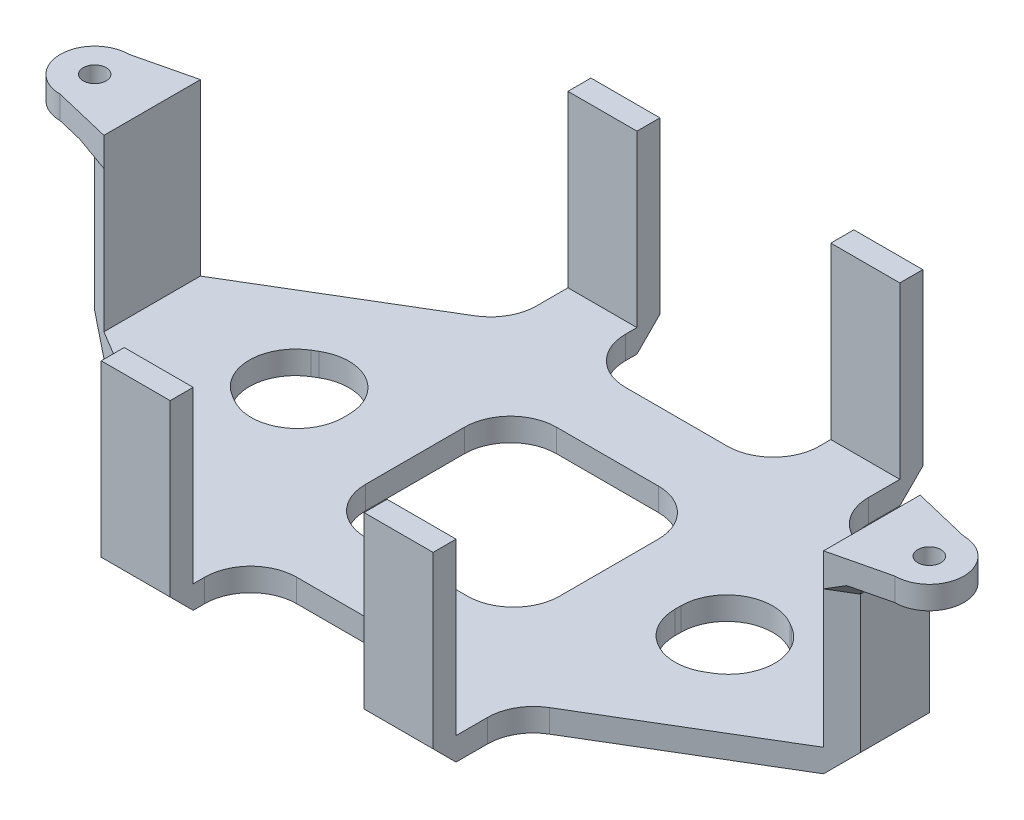
from build123d import *

# Parameters (mm, degrees)
SKETCH1_W           = 21.420666666
SKETCH1_H           = 21.082
BOSS_EXTRUDE1_DEPTH = 2.54
SKETCH2_W           = 7.62
SKETCH2_H           = 2.54
BOSS_EXTRUDE2_DEPTH = 18.796
FILLET1_R           = 5.08
CHAMFER1_SIZE       = 2.54
SKETCH3_R           = 1.27
BOSS_EXTRUDE3_DEPTH = 2.54
CHAMFER2_SIZE       = 0.635
CHAMFER2_SIZE_2     = 1.099852263


with BuildPart() as part:
    # Sketch1 → Boss-Extrude1 (new body)
    with BuildSketch(Plane(origin=(0, 0, 0), x_dir=(1, 0, 0), z_dir=(0, 1, 0))):
        Polygon((-2.54, 28.321), (21.420666667, 42.672), (21.420666667, 51.562), (29.040666667, 51.562), (29.040666667, 42.672), (50.461333333, 42.672), (50.461333333, 51.562), (58.081333333, 51.562), (58.081333333, 42.672), (82.042, 28.321), (82.042, 20.701), (58.081333333, 6.35), (58.081333333, -2.54), (50.461333333, -2.54), (50.461333333, 6.35), (29.040666667, 6.35), (29.040666667, -2.54), (21.420666667, -2.54), (21.420666667, 6.35), (-2.54, 20.701), align=None)
        Polygon((5.928658004, 24.511), (21.420666667, 33.789782574), (21.420666667, 15.232217426), align=None, mode=Mode.SUBTRACT)
        with Locations((39.751, 24.511)):
            Rectangle(SKETCH1_W, SKETCH1_H, mode=Mode.SUBTRACT)
        Polygon((58.081333333, 33.789782574), (73.573341996, 24.511), (58.081333333, 15.232217426), align=None, mode=Mode.SUBTRACT)
    extrude(amount=BOSS_EXTRUDE1_DEPTH)

    # Sketch2 → Boss-Extrude2 (add)
    with BuildSketch(Plane(origin=(0, 2.54, 0), x_dir=(1, 0, 0), z_dir=(0, 1, 0))):
        with Locations((25.230666667, 50.292)):
            Rectangle(SKETCH2_W, SKETCH2_H)
        with Locations((54.271333333, 50.292)):
            Rectangle(SKETCH2_W, SKETCH2_H)
        with Locations((25.230666667, -1.27)):
            Rectangle(SKETCH2_W, SKETCH2_H)
        with Locations((54.271333333, -1.27)):
            Rectangle(SKETCH2_W, SKETCH2_H)
        Polygon((-2.54, 20.701), (0, 19.17969258), (0, 29.84230742), (-2.54, 28.321), align=None)
        Polygon((82.042, 28.321), (79.502, 29.84230742), (79.502, 19.17969258), (82.042, 20.701), align=None)
    extrude(amount=BOSS_EXTRUDE2_DEPTH)

    # Fillet1
    fillet1_edges = [part.edges().sort_by_distance(p)[0] for p in [
        (29.040666667, 1.27, -42.672),
        (50.461333333, 1.27, -42.672),
        (58.081333333, 1.27, -42.672),
        (58.081333333, 1.27, -6.35),
        (50.461333333, 1.27, -6.35),
        (29.040666667, 1.27, -6.35),
        (21.420666667, 1.27, -6.35),
        (21.420666667, 1.27, -42.672),
        (5.928658004, 1.27, -24.511),
        (21.420666667, 1.27, -15.232217426),
        (21.420666667, 1.27, -33.789782574),
        (58.081333333, 1.27, -15.232217426),
        (73.573341996, 1.27, -24.511),
        (58.081333333, 1.27, -33.789782574),
        (29.040666667, 1.27, -35.052),
        (29.040666667, 1.27, -13.97),
        (50.461333333, 1.27, -13.97),
        (50.461333333, 1.27, -35.052),
    ]]
    fillet(fillet1_edges, radius=FILLET1_R)

    # Chamfer1
    chamfer1_edges = [part.edges().sort_by_distance(p)[0] for p in [
        (25.230666667, 0, -51.562),
        (54.271333333, 0, -51.562),
        (82.042, 0, -24.511),
        (54.271333333, 0, 2.54),
        (25.230666667, 0, 2.54),
        (-2.54, 0, -24.511),
    ]]
    chamfer(chamfer1_edges, length=CHAMFER1_SIZE)

    # Sketch3 → Boss-Extrude3 (add)
    # profile 1 of 2: a face of its own
    with BuildSketch(Plane(origin=(0, 21.336, 0), x_dir=(1, 0, 0), z_dir=(0, 1, 0))):
        with BuildLine():
            Line((-6.35, 28.321), (0, 29.84230742))
            Line((0, 29.84230742), (0, 19.17969258))
            Line((0, 19.17969258), (-6.35, 20.701))
            ThreePointArc((-6.35, 20.701), (-10.16, 24.511), (-6.35, 28.321))
        make_face()
        with Locations(Location((-6.35, 24.511, 0), (0, 0, 270))):
            Circle(SKETCH3_R, mode=Mode.SUBTRACT)
    # profile 2 of 2: a face of its own
    with BuildSketch(Plane(origin=(0, 21.336, 0), x_dir=(1, 0, 0), z_dir=(0, 1, 0))):
        with BuildLine():
            Line((79.502, 19.17969258), (85.852, 20.701))
            ThreePointArc((85.852, 20.701), (89.662, 24.511), (85.852, 28.321))
            Line((85.852, 28.321), (79.502, 29.84230742))
            Line((79.502, 29.84230742), (79.502, 19.17969258))
        make_face()
        with Locations(Location((85.852, 24.511, 0), (0, 0, 90))):
            Circle(SKETCH3_R, mode=Mode.SUBTRACT)
    extrude(amount=-BOSS_EXTRUDE3_DEPTH)

    # Chamfer2
    # the kernel refuses this chamfer: 1.099852263, 0.635 mm, written as the material it adds along each edge
    with BuildSketch(Plane(origin=(2.441061654, 18.796, -31.304356715), x_dir=(0, -1, 0), z_dir=(-0.8578938832772348, 0, 0.5138269018215241))) as chamfer2_piece_1_section:
        Polygon((CHAMFER2_SIZE, 0), (0, -CHAMFER2_SIZE_2), (0, 0), align=None)
    chamfer2_piece_1 = extrude(amount=8.651563385, mode=Mode.PRIVATE)
    chamfer2_piece_1 = split(chamfer2_piece_1, bisect_by=Plane(origin=(-2.54, 18.796, -31.304356715), z_dir=(1, 0, 0)), keep=Keep.TOP, mode=Mode.PRIVATE)
    chamfer2_piece_1 = split(chamfer2_piece_1, bisect_by=Plane(origin=(2.639816898, 18.796, -30.474744119), z_dir=(0.2329830326651444, 0, 0.9724808000624754)), keep=Keep.TOP, mode=Mode.PRIVATE)
    add(chamfer2_piece_1)
    with BuildSketch(Plane(origin=(-2.54, 18.796, -31.166412121), x_dir=(-1, 0, 0), z_dir=(0, 0, 1))) as chamfer2_piece_2_section:
        Polygon((CHAMFER2_SIZE_2, 0), (0, CHAMFER2_SIZE), (0, 0), align=None)
    chamfer2_piece_2 = extrude(amount=13.310824243, mode=Mode.PRIVATE)
    chamfer2_piece_2 = split(chamfer2_piece_2, bisect_by=Plane(origin=(-1.285716853, 18.796, -29.072240259), z_dir=(0.5138269018215241, 0, 0.8578938832772348)), keep=Keep.TOP, mode=Mode.PRIVATE)
    chamfer2_piece_2 = split(chamfer2_piece_2, bisect_by=Plane(origin=(-7.153247393, 18.796, -23.464058067), z_dir=(0.5138269018215242, 0, -0.8578938832772348)), keep=Keep.TOP, mode=Mode.PRIVATE)
    add(chamfer2_piece_2)
    with BuildSketch(Plane(origin=(-4.981061654, 18.796, -22.163049295), x_dir=(-0.5138269018215241, -3.2301735414316882e-15, 0.8578938832772347), z_dir=(0.8578938832772348, 0, 0.5138269018215242))) as chamfer2_piece_3_section:
        Polygon((CHAMFER2_SIZE_2, 0), (0, CHAMFER2_SIZE), (0, 0), align=None)
    chamfer2_piece_3 = extrude(amount=8.651563385, mode=Mode.PRIVATE)
    chamfer2_piece_3 = split(chamfer2_piece_3, bisect_by=Plane(origin=(-2.54, 18.796, -22.163049295), z_dir=(1, 0, 0)), keep=Keep.TOP, mode=Mode.PRIVATE)
    chamfer2_piece_3 = split(chamfer2_piece_3, bisect_by=Plane(origin=(-5.386627864, 18.796, -20.470199184), z_dir=(0.2329830326651444, 0, -0.9724808000624754)), keep=Keep.TOP, mode=Mode.PRIVATE)
    add(chamfer2_piece_3)
    with BuildSketch(Plane(origin=(82.042, 18.796, -31.166412121), x_dir=(0, -1, 0), z_dir=(0, 0, 1))) as chamfer2_piece_4_section:
        Polygon((CHAMFER2_SIZE_2, 0), (0, CHAMFER2_SIZE), (0, 0), align=None)
    chamfer2_piece_4 = extrude(amount=13.310824243, mode=Mode.PRIVATE)
    chamfer2_piece_4 = split(chamfer2_piece_4, bisect_by=Plane(origin=(80.787716853, 18.796, -29.072240259), z_dir=(-0.5138269018215241, 0, 0.8578938832772348)), keep=Keep.TOP, mode=Mode.PRIVATE)
    chamfer2_piece_4 = split(chamfer2_piece_4, bisect_by=Plane(origin=(86.655247393, 18.796, -23.464058067), z_dir=(-0.5138269018215241, 0, -0.8578938832772349)), keep=Keep.TOP, mode=Mode.PRIVATE)
    add(chamfer2_piece_4)
    with BuildSketch(Plane(origin=(84.483061654, 18.796, -22.163049295), x_dir=(0, -1, 0), z_dir=(-0.8578938832772349, 0, 0.5138269018215241))) as chamfer2_piece_5_section:
        Polygon((CHAMFER2_SIZE_2, 0), (0, CHAMFER2_SIZE), (0, 0), align=None)
    chamfer2_piece_5 = extrude(amount=8.651563385, mode=Mode.PRIVATE)
    chamfer2_piece_5 = split(chamfer2_piece_5, bisect_by=Plane(origin=(82.042, 18.796, -22.163049295), z_dir=(-1, 0, 0)), keep=Keep.TOP, mode=Mode.PRIVATE)
    chamfer2_piece_5 = split(chamfer2_piece_5, bisect_by=Plane(origin=(84.888627864, 18.796, -20.470199184), z_dir=(-0.23298303266514464, 0, -0.9724808000624754)), keep=Keep.TOP, mode=Mode.PRIVATE)
    add(chamfer2_piece_5)
    with BuildSketch(Plane(origin=(77.060938346, 18.796, -31.304356715), x_dir=(0, -1, 0), z_dir=(0.8578938832772348, 0, 0.5138269018215241))) as chamfer2_piece_6_section:
        Polygon((CHAMFER2_SIZE_2, 0), (0, CHAMFER2_SIZE), (0, 0), align=None)
    chamfer2_piece_6 = extrude(amount=8.651563385, mode=Mode.PRIVATE)
    chamfer2_piece_6 = split(chamfer2_piece_6, bisect_by=Plane(origin=(82.042, 18.796, -31.304356715), z_dir=(-1, 0, 0)), keep=Keep.TOP, mode=Mode.PRIVATE)
    chamfer2_piece_6 = split(chamfer2_piece_6, bisect_by=Plane(origin=(76.862183102, 18.796, -30.474744119), z_dir=(-0.23298303266514414, 0, 0.9724808000624755)), keep=Keep.TOP, mode=Mode.PRIVATE)
    add(chamfer2_piece_6)
    with BuildSketch(Plane(origin=(2.441061654, 18.796, -31.304356715), x_dir=(0, -1, 0), z_dir=(-0.8578938832772348, 0, 0.5138269018215241))) as chamfer2_piece_7a_section:
        Polygon((CHAMFER2_SIZE, 0), (0, -CHAMFER2_SIZE_2), (0, 0), align=None)
    chamfer2_piece_7a = extrude(amount=8.651563385, mode=Mode.PRIVATE)
    chamfer2_piece_7a = split(chamfer2_piece_7a, bisect_by=Plane(origin=(-2.54, 18.796, -31.304356715), z_dir=(-1, 0, 0)), keep=Keep.TOP, mode=Mode.PRIVATE)
    chamfer2_piece_7a = split(chamfer2_piece_7a, bisect_by=Plane(origin=(2.639816898, 18.796, -30.474744119), z_dir=(0.2329830326651444, 0, 0.9724808000624754)), keep=Keep.TOP, mode=Mode.PRIVATE)
    with BuildSketch(Plane(origin=(-2.54, 18.796, -31.166412121), x_dir=(-1, 0, 0), z_dir=(0, 0, 1))) as chamfer2_piece_7b_section:
        Polygon((CHAMFER2_SIZE_2, 0), (0, CHAMFER2_SIZE), (0, 0), align=None)
    chamfer2_piece_7b = extrude(amount=13.310824243, mode=Mode.PRIVATE)
    chamfer2_piece_7b = split(chamfer2_piece_7b, bisect_by=Plane(origin=(-1.285716853, 18.796, -29.072240259), z_dir=(-0.5138269018215241, 0, -0.8578938832772348)), keep=Keep.TOP, mode=Mode.PRIVATE)
    chamfer2_piece_7b = split(chamfer2_piece_7b, bisect_by=Plane(origin=(-2.1021216, 18.796, -29.338689596), z_dir=(0.2329830326651444, 0, 0.9724808000624754)), keep=Keep.TOP, mode=Mode.PRIVATE)
    chamfer2_piece_7 = chamfer2_piece_7a & chamfer2_piece_7b
    add(chamfer2_piece_7)
    with BuildSketch(Plane(origin=(-4.981061654, 18.796, -22.163049295), x_dir=(-0.5138269018215241, -3.2301735414316882e-15, 0.8578938832772347), z_dir=(0.8578938832772348, 0, 0.5138269018215242))) as chamfer2_piece_8a_section:
        Polygon((CHAMFER2_SIZE_2, 0), (0, CHAMFER2_SIZE), (0, 0), align=None)
    chamfer2_piece_8a = extrude(amount=8.651563385, mode=Mode.PRIVATE)
    chamfer2_piece_8a = split(chamfer2_piece_8a, bisect_by=Plane(origin=(-2.54, 18.796, -22.163049295), z_dir=(-1, 0, 0)), keep=Keep.TOP, mode=Mode.PRIVATE)
    chamfer2_piece_8a = split(chamfer2_piece_8a, bisect_by=Plane(origin=(-5.386627864, 18.796, -20.470199184), z_dir=(0.2329830326651444, 0, -0.9724808000624754)), keep=Keep.TOP, mode=Mode.PRIVATE)
    with BuildSketch(Plane(origin=(-2.54, 18.796, -31.166412121), x_dir=(-1, 0, 0), z_dir=(0, 0, 1))) as chamfer2_piece_8b_section:
        Polygon((CHAMFER2_SIZE_2, 0), (0, CHAMFER2_SIZE), (0, 0), align=None)
    chamfer2_piece_8b = extrude(amount=13.310824243, mode=Mode.PRIVATE)
    chamfer2_piece_8b = split(chamfer2_piece_8b, bisect_by=Plane(origin=(-7.153247393, 18.796, -23.464058067), z_dir=(-0.5138269018215242, 0, 0.8578938832772348)), keep=Keep.TOP, mode=Mode.PRIVATE)
    chamfer2_piece_8b = split(chamfer2_piece_8b, bisect_by=Plane(origin=(-5.117975361, 18.796, -20.4058365), z_dir=(0.2329830326651444, 0, -0.9724808000624754)), keep=Keep.TOP, mode=Mode.PRIVATE)
    chamfer2_piece_8 = chamfer2_piece_8a & chamfer2_piece_8b
    add(chamfer2_piece_8)
    with BuildSketch(Plane(origin=(77.060938346, 18.796, -31.304356715), x_dir=(0, -1, 0), z_dir=(0.8578938832772348, 0, 0.5138269018215241))) as chamfer2_piece_9a_section:
        Polygon((CHAMFER2_SIZE_2, 0), (0, CHAMFER2_SIZE), (0, 0), align=None)
    chamfer2_piece_9a = extrude(amount=8.651563385, mode=Mode.PRIVATE)
    chamfer2_piece_9a = split(chamfer2_piece_9a, bisect_by=Plane(origin=(82.042, 18.796, -31.304356715), z_dir=(1, 0, 0)), keep=Keep.TOP, mode=Mode.PRIVATE)
    with BuildSketch(Plane(origin=(82.042, 18.796, -31.166412121), x_dir=(0, -1, 0), z_dir=(0, 0, 1))) as chamfer2_piece_9b_section:
        Polygon((CHAMFER2_SIZE_2, 0), (0, CHAMFER2_SIZE), (0, 0), align=None)
    chamfer2_piece_9b = extrude(amount=13.310824243, mode=Mode.PRIVATE)
    chamfer2_piece_9b = split(chamfer2_piece_9b, bisect_by=Plane(origin=(80.787716853, 18.796, -29.072240259), z_dir=(0.5138269018215241, 0, -0.8578938832772348)), keep=Keep.TOP, mode=Mode.PRIVATE)
    chamfer2_piece_9b = split(chamfer2_piece_9b, bisect_by=Plane(origin=(81.6041216, 18.796, -29.338689596), z_dir=(-0.23298303266514414, 0, 0.9724808000624755)), keep=Keep.TOP, mode=Mode.PRIVATE)
    chamfer2_piece_9 = chamfer2_piece_9a & chamfer2_piece_9b
    add(chamfer2_piece_9)
    with BuildSketch(Plane(origin=(84.483061654, 18.796, -22.163049295), x_dir=(0, -1, 0), z_dir=(-0.8578938832772349, 0, 0.5138269018215241))) as chamfer2_piece_10a_section:
        Polygon((CHAMFER2_SIZE_2, 0), (0, CHAMFER2_SIZE), (0, 0), align=None)
    chamfer2_piece_10a = extrude(amount=8.651563385, mode=Mode.PRIVATE)
    chamfer2_piece_10a = split(chamfer2_piece_10a, bisect_by=Plane(origin=(82.042, 18.796, -22.163049295), z_dir=(1, 0, 0)), keep=Keep.TOP, mode=Mode.PRIVATE)
    with BuildSketch(Plane(origin=(82.042, 18.796, -31.166412121), x_dir=(0, -1, 0), z_dir=(0, 0, 1))) as chamfer2_piece_10b_section:
        Polygon((CHAMFER2_SIZE_2, 0), (0, CHAMFER2_SIZE), (0, 0), align=None)
    chamfer2_piece_10b = extrude(amount=13.310824243, mode=Mode.PRIVATE)
    chamfer2_piece_10b = split(chamfer2_piece_10b, bisect_by=Plane(origin=(86.655247393, 18.796, -23.464058067), z_dir=(0.5138269018215241, 0, 0.8578938832772349)), keep=Keep.TOP, mode=Mode.PRIVATE)
    chamfer2_piece_10b = split(chamfer2_piece_10b, bisect_by=Plane(origin=(84.619975361, 18.796, -20.4058365), z_dir=(-0.23298303266514464, 0, -0.9724808000624754)), keep=Keep.TOP, mode=Mode.PRIVATE)
    chamfer2_piece_10 = chamfer2_piece_10a & chamfer2_piece_10b
    add(chamfer2_piece_10)


solid = part.part
